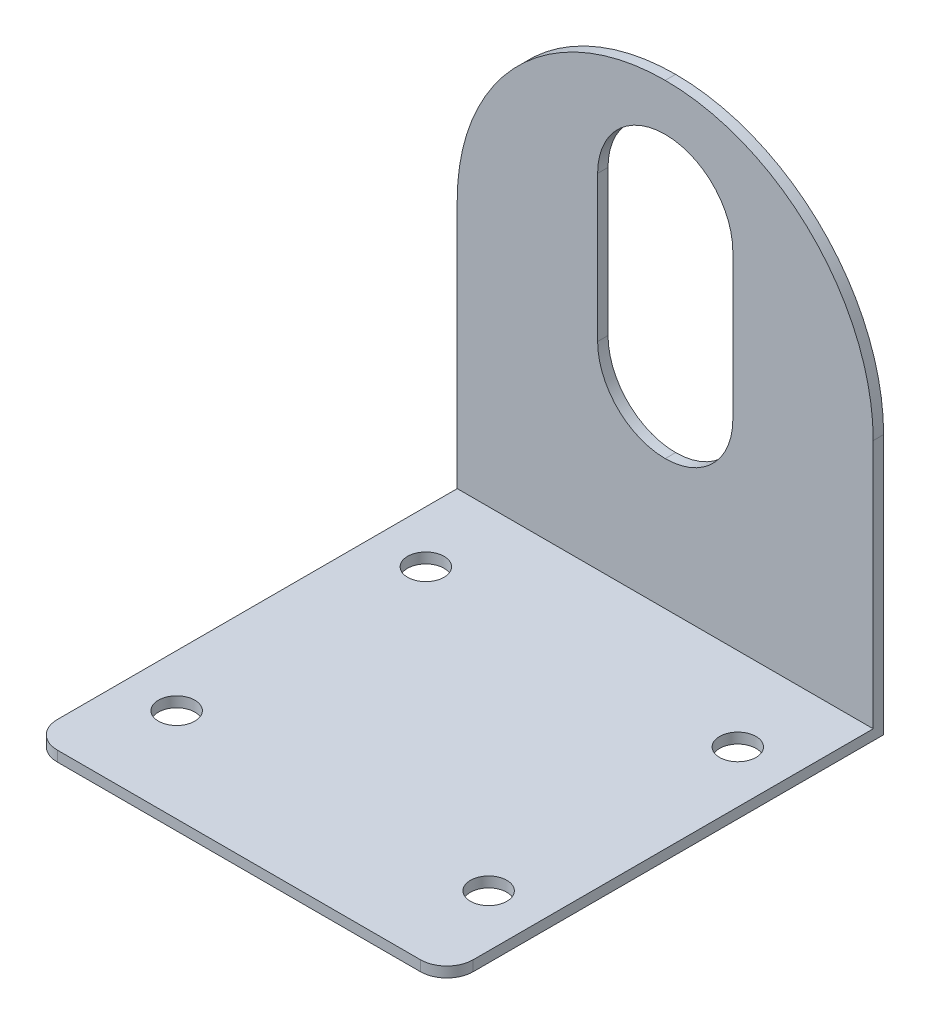
from build123d import *

# Parameters (mm, degrees)
SKETCH1_W             = 40
SKETCH1_H             = 44.999999916
VERTICAL_BASE_DEPTH   = 1
TOP_ROUNDING_R        = 20
TOP_ROUNDING_2_R      = 20
SKETCH2_W             = 40
SKETCH2_H             = 1
HORIZONTAL_BASE_DEPTH = 41
FILLET3_R             = 2.54
FILLET4_R             = 2.54
SKETCH3_R             = 1.75
MOUNTING_HOLES_DEPTH  = 73.801098842
SKETCH5_W             = 13
SKETCH5_H             = 27
CUT_EXTRUDE2_DEPTH    = 74.409808557
FILLET5_R             = 6.5
FILLET6_R             = 6.5
FILLET7_R             = 6.5
FILLET8_R             = 6.5


with BuildPart() as part:
    # Sketch1 → Vertical-Base (new body)
    with BuildSketch(Plane.XY):
        with Locations((20, 22.499999958)):
            Rectangle(SKETCH1_W, SKETCH1_H)
    extrude(amount=VERTICAL_BASE_DEPTH)

    # Top-Rounding
    top_rounding_edges = [part.edges().sort_by_distance(p)[0] for p in [
        (0, 44.999999916, 0.5),
    ]]
    fillet(top_rounding_edges, radius=TOP_ROUNDING_R)

    # Top-Rounding-2
    top_rounding_2_edges = [part.edges().sort_by_distance(p)[0] for p in [
        (40, 44.999999916, 0.5),
    ]]
    fillet(top_rounding_2_edges, radius=TOP_ROUNDING_2_R - 0.0001)  # a hair under: the kernel refuses the full size

    # Sketch2 → Horizontal-Base (add)
    with BuildSketch(Plane.XY.offset(1)):
        with Locations((20, 0.5)):
            Rectangle(SKETCH2_W, SKETCH2_H)
    extrude(amount=HORIZONTAL_BASE_DEPTH)

    # Fillet3
    fillet3_edges = [part.edges().sort_by_distance(p)[0] for p in [
        (40, 0.5, 42),
    ]]
    fillet(fillet3_edges, radius=FILLET3_R)

    # Fillet4
    fillet4_edges = [part.edges().sort_by_distance(p)[0] for p in [
        (0, 0.5, 42),
    ]]
    fillet(fillet4_edges, radius=FILLET4_R)

    # Sketch3 → Mounting Holes (cut, through all)
    with BuildSketch(Plane(origin=(0, 1, 0), x_dir=(1, 0, 0), z_dir=(0, 1, 0))):
        with Locations(Location((35, -32.979707006, 0), (0, 0, 270))):
            Circle(SKETCH3_R)
        with Locations(Location((5, -32.979707006, 0), (0, 0, 270))):
            Circle(SKETCH3_R)
        with Locations(Location((5, -9.020292994, 0), (0, 0, 270))):
            Circle(SKETCH3_R)
        with Locations(Location((35, -9.020292994, 0), (0, 0, 270))):
            Circle(SKETCH3_R)
    extrude(amount=-MOUNTING_HOLES_DEPTH, mode=Mode.SUBTRACT)

    # Sketch5 → Cut-Extrude2 (cut, through all)
    with BuildSketch(Plane(origin=(0, 0, 0), x_dir=(-1, 0, 0), z_dir=(0, 0, -1))):
        with Locations((-20, 27)):
            Rectangle(SKETCH5_W, SKETCH5_H)
    extrude(amount=-CUT_EXTRUDE2_DEPTH, mode=Mode.SUBTRACT)

    # Fillet5
    fillet5_edges = [part.edges().sort_by_distance(p)[0] for p in [
        (13.5, 40.5, 0.5),
    ]]
    fillet(fillet5_edges, radius=FILLET5_R)

    # Fillet6
    fillet6_edges = [part.edges().sort_by_distance(p)[0] for p in [
        (26.5, 40.5, 0.5),
    ]]
    fillet(fillet6_edges, radius=FILLET6_R - 0.0001)  # a hair under: the kernel refuses the full size

    # Fillet7
    fillet7_edges = [part.edges().sort_by_distance(p)[0] for p in [
        (13.5, 13.5, 0.5),
    ]]
    fillet(fillet7_edges, radius=FILLET7_R)

    # Fillet8
    fillet8_edges = [part.edges().sort_by_distance(p)[0] for p in [
        (26.5, 13.5, 0.5),
    ]]
    fillet(fillet8_edges, radius=FILLET8_R - 0.0001)  # a hair under: the kernel refuses the full size


solid = part.part
